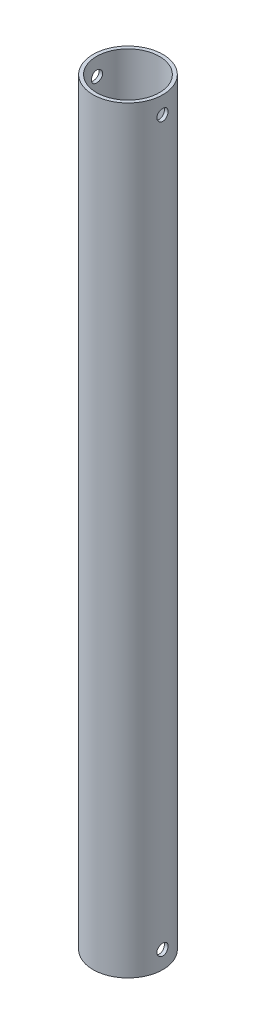
from build123d import *

# Parameters (mm, degrees)
SKETCH1_R            = 10
SKETCH1_R_2          = 9
BOSS_EXTRUDE1_DEPTH  = 217
M3_CLEARANCE_HOLE1_D = 3.2


with BuildPart() as part:
    # Sketch1 → Boss-Extrude1 (new body)
    with BuildSketch(Plane(origin=(0, 0, 0), x_dir=(1, 0, 0), z_dir=(0, 1, 0))):
        Circle(SKETCH1_R)
        Circle(SKETCH1_R_2, mode=Mode.SUBTRACT)
    extrude(amount=BOSS_EXTRUDE1_DEPTH)

    # M3 Clearance Hole1 (through all)
    with Locations(Plane.ZY.offset(10)):
        with Locations((0, 5)):
            m3_clearance_hole1 = Hole(M3_CLEARANCE_HOLE1_D / 2)

    # Mirror1: M3 Clearance Hole1 across plane
    add(m3_clearance_hole1.mirror(Plane.ZX.offset(108.5)), mode=Mode.SUBTRACT)


solid = part.part
